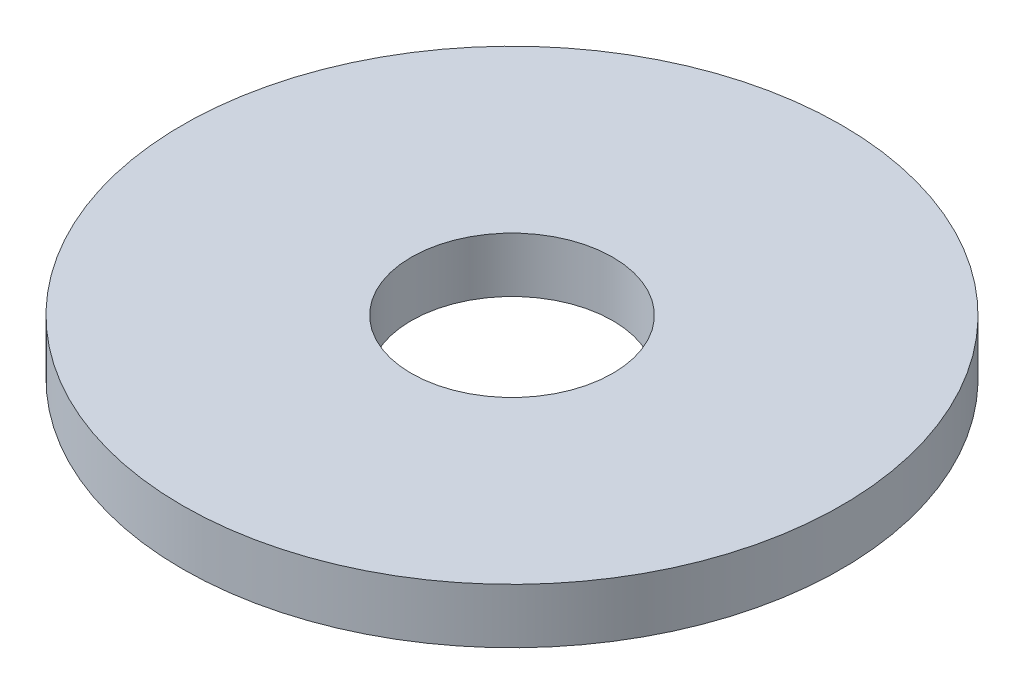
from build123d import *

# Parameters (mm, degrees)
SKETCH1_R          = 36
BASE_EXTRUDE_DEPTH = 6
SKETCH2_R          = 11
TYPE_R_DEPTH       = 52.264022472


with BuildPart() as part:
    # Sketch1 → Base-Extrude (new body)
    with BuildSketch(Plane(origin=(0, 0, 0), x_dir=(1, 0, 0), z_dir=(0, 1, 0))):
        Circle(SKETCH1_R)
    extrude(amount=-BASE_EXTRUDE_DEPTH)

    # Sketch2 → Type-R (cut, through all)
    with BuildSketch(Plane(origin=(0, 0, 0), x_dir=(-1, 0, 0), z_dir=(0, 1, 0))):
        Circle(SKETCH2_R)
    extrude(amount=-TYPE_R_DEPTH, mode=Mode.SUBTRACT)


solid = part.part
